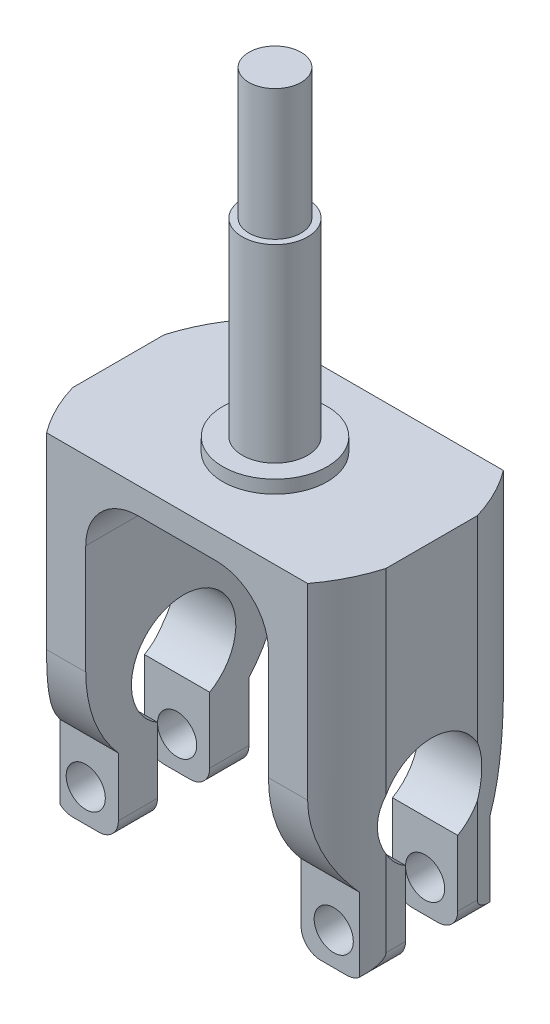
from build123d import *

# Parameters (mm, degrees)
SKETCH_1_R          = 12.5
EXTRUDE_1_DEPTH     = 27
CUT_EXTRUDE_START   = -37
CUT_EXTRUDE_1_DEPTH = 37
CUT_EXTRUDE_START_2 = 10
CUT_EXTRUDE_2_DEPTH = 43
SKETCH_4_W          = 14
SKETCH_4_H          = 25
CUT_EXTRUDE_3_DEPTH = 30
FILLET_1_R          = 4
SKETCH_7_R          = 4
SKETCH_5_R          = 4
CUT_EXTRUDE_4_DEPTH = 34
SKETCH_9_W          = 2.5
SKETCH_9_H          = 6
CUT_EXTRUDE_5_DEPTH = 34
SKETCH_10_R         = 1.5
CUT_EXTRUDE_6_DEPTH = 34
FILLET_3_R          = 1.5
SKETCH_11_R         = 2.5
EXTRUDE_2_DEPTH     = 14.5
SKETCH_12_R         = 2
EXTRUDE_3_DEPTH     = 10
FILLET_4_R          = 10


with BuildPart() as part:
    # 草图1 → 凸台-拉伸1 (new body)
    with BuildSketch(Plane(origin=(0, 0, 0), x_dir=(1, 0, 0), z_dir=(0, 1, 0))):
        with Locations(Location((0, 0, 0), (0, 0, 270))):
            Circle(SKETCH_1_R)
    extrude(amount=-EXTRUDE_1_DEPTH)

    # 草图2 → 切除-拉伸1 (cut)
    with BuildSketch(Plane(origin=(0, -27, 0), x_dir=(-1, 0, 0), z_dir=(0, -1, 0)).offset(CUT_EXTRUDE_START)):
        with BuildLine():
            Line((-10, 7.5), (10, 7.5))
            ThreePointArc((10, 7.5), (0, 12.5), (-10, 7.5))
        make_face()
        with BuildLine():
            Line((-10, -7.5), (10, -7.5))
            ThreePointArc((10, -7.5), (0, -12.5), (-10, -7.5))
        make_face()
    extrude(amount=CUT_EXTRUDE_1_DEPTH, mode=Mode.SUBTRACT)

    # 草图3 → 切除-拉伸2 (cut)
    with BuildSketch(Plane(origin=(0, 0, 0), x_dir=(1, 0, 0), z_dir=(0, 1, 0)).offset(CUT_EXTRUDE_START_2)):
        with BuildLine():
            Line((-12, 3.5), (-12, -3.5))
            ThreePointArc((-12, -3.5), (-12.5, 0), (-12, 3.5))
        make_face()
        with BuildLine():
            Line((12, 3.5), (12, -3.5))
            ThreePointArc((12, -3.5), (12.5, 0), (12, 3.5))
        make_face()
    extrude(amount=-CUT_EXTRUDE_2_DEPTH, mode=Mode.SUBTRACT)

    # 草图4 → 切除-拉伸3 (cut)
    with BuildSketch(Plane.XY.offset(7.5)):
        with Locations((0, -14.5)):
            Rectangle(SKETCH_4_W, SKETCH_4_H)
    extrude(amount=-CUT_EXTRUDE_3_DEPTH, mode=Mode.SUBTRACT)

    # 圆角1
    fillet_1_edges = [part.edges().sort_by_distance(p)[0] for p in [
        (-7, -2, 0),
        (7, -2, 0),
    ]]
    fillet(fillet_1_edges, radius=FILLET_1_R)

    # 草图7 → 放样2 section 0
    with BuildSketch(Plane(origin=(0, 0, 0), x_dir=(1, 0, 0), z_dir=(0, 1, 0))):
        Circle(SKETCH_7_R)
    # 草图5 → 放样2 section 1
    with BuildSketch(Plane(origin=(0, 1, 0), x_dir=(1, 0, 0), z_dir=(0, 1, 0))):
        Circle(SKETCH_5_R)
    loft()

    # 草图8 → 切除-拉伸4 (cut)
    with BuildSketch(Plane.ZY.offset(12)):
        with BuildLine():
            Line((-2, -27), (2, -27))
            Line((2, -27), (2, -20.464101615))
            ThreePointArc((2, -20.464101615), (0, -13), (-2, -20.464101615))
            Line((-2, -20.464101615), (-2, -27))
        make_face()
    extrude(amount=-CUT_EXTRUDE_4_DEPTH, mode=Mode.SUBTRACT)

    # 草图9 → 切除-拉伸5 (cut)
    with BuildSketch(Plane.ZY.offset(12)):
        with Locations((6.25, -24)):
            Rectangle(SKETCH_9_W, SKETCH_9_H)
        with Locations((-6.25, -24)):
            Rectangle(SKETCH_9_W, SKETCH_9_H)
    extrude(amount=-CUT_EXTRUDE_5_DEPTH, mode=Mode.SUBTRACT)

    # 草图10 → 切除-拉伸6 (cut)
    with BuildSketch(Plane.XY.offset(5)):
        with Locations(Location((-9.5, -24.5, 0), (0, 0, 270))):
            Circle(SKETCH_10_R)
        with Locations(Location((9.5, -24.5, 0), (0, 0, 270))):
            Circle(SKETCH_10_R)
    extrude(amount=-CUT_EXTRUDE_6_DEPTH, mode=Mode.SUBTRACT)

    # 圆角3
    fillet_3_edges = [part.edges().sort_by_distance(p)[0] for p in [
        (-12, -27, 2.75),
        (-12, -27, -2.75),
        (-7, -27, -3.5),
        (-7, -27, 3.5),
        (7, -27, -3.5),
        (7, -27, 3.5),
        (12, -27, 2.75),
        (12, -27, -2.75),
    ]]
    fillet(fillet_3_edges, radius=FILLET_3_R)

    # 草图11 → 凸台-拉伸2 (add)
    with BuildSketch(Plane(origin=(0, 1, 0), x_dir=(1, 0, 0), z_dir=(0, 1, 0))):
        with Locations(Location((0, 0, 0), (0, 0, 90))):
            Circle(SKETCH_11_R)
    extrude(amount=EXTRUDE_2_DEPTH)

    # 草图12 → 凸台-拉伸3 (add)
    with BuildSketch(Plane(origin=(0, 15.5, 0), x_dir=(1, 0, 0), z_dir=(0, 1, 0))):
        with Locations(Location((0, 0, 0), (0, 0, 270))):
            Circle(SKETCH_12_R)
    extrude(amount=EXTRUDE_3_DEPTH)

    # 圆角4
    # the kernel refuses this fillet: 10 mm, written as the material it takes off along each edge
    with BuildSketch(Plane(origin=(-9.535945694, -21, 7.5), x_dir=(0, 1, 0), z_dir=(1, 0, 0)), Plane(origin=(-26.535945694, -21, 7.5), x_dir=(0, 1, 0), z_dir=(1, 0, 0))) as fillet_4_piece_1:
        with BuildLine():
            CenterArc((6.614378278, -10), FILLET_4_R, 90, 41.409622109)
            Line((0, -2.5), (-0.132287566, -2.35))
            ThreePointArc((-0.132287566, -2.35), (-0.2, -1.25), (-0.2, 0))
            Line((-0.2, 0), (0, 0.2))
            Line((0, 0.2), (6.614378278, 0.2))
            Line((6.614378278, 0.2), (6.614378278, 0))
        make_face()
    extrude(amount=36.071891388, mode=Mode.SUBTRACT)
    with BuildSketch(Plane(origin=(-9.535945694, -21, -7.5), x_dir=(0, 0, 1), z_dir=(1, 0, 0))) as fillet_4_piece_2:
        with BuildLine():
            CenterArc((10, -6.614378278), FILLET_4_R, 138.590377891, 41.409622109)
            Line((0, -6.614378278), (-0.2, -6.614378278))
            Line((-0.2, -6.614378278), (-0.2, 0))
            Line((-0.2, 0), (0, 0.2))
            ThreePointArc((0, 0.2), (1.25, 0.2), (2.35, 0.132287566))
            Line((2.35, 0.132287566), (2.5, 0))
        make_face()
    extrude(amount=36.071891388, mode=Mode.SUBTRACT)
    with BuildSketch(Plane(origin=(-26.535945694, -21, -7.5), x_dir=(0, 1, 0), z_dir=(1, 0, 0))) as fillet_4_piece_3:
        with BuildLine():
            CenterArc((6.614378278, 10), FILLET_4_R, 228.590377891, 41.409622109)
            Line((0, 2.5), (-0.132287566, 2.35))
            ThreePointArc((-0.132287566, 2.35), (-0.2, 1.25), (-0.2, 0))
            Line((-0.2, 0), (0, -0.2))
            Line((0, -0.2), (6.614378278, -0.2))
            Line((6.614378278, -0.2), (6.614378278, 0))
        make_face()
    extrude(amount=36.071891388, mode=Mode.SUBTRACT)


solid = part.part
